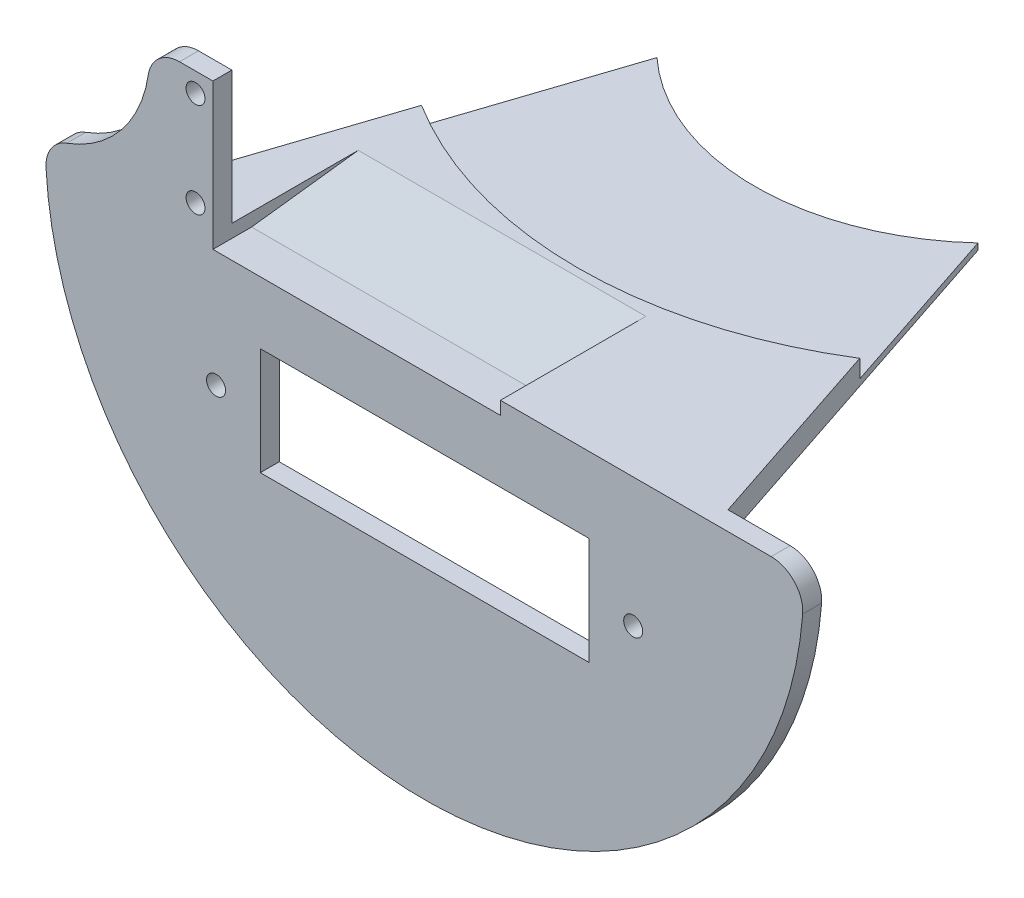
from build123d import *

# Parameters (mm, degrees)
SKETCH1_R           = 1.5
SKETCH1_W           = 52
SKETCH1_H           = 17
BOSS_EXTRUDE1_DEPTH = 3
BOSS_EXTRUDE2_DEPTH = 1
BOSS_EXTRUDE3_DEPTH = 2.822688649
FILLET1_R           = 20
FILLET3_R           = 5
SKETCH6_W           = 45.5
SKETCH6_H           = 2.072688649
CUT_EXTRUDE1_DEPTH  = 3
CHAMFER2_SIZE       = 20
CHAMFER2_SIZE_2     = 2.455691218


with BuildPart() as part:
    # Sketch1 → Boss-Extrude1 (new body)
    with BuildSketch(Plane.XY):
        with BuildLine():
            Line((-33.5, 56.672688649), (-43.5, 56.672688649))
            Line((-43.5, 56.672688649), (-43.5, 35.672688649))
            Line((-43.5, 35.672688649), (-59.995312317, 35.672688649))
            ThreePointArc((-59.995312317, 35.672688649), (-59.999578012, 34.697658936), (-59.9879988, 33.722688649))
            ThreePointArc((-59.9879988, 33.722688649), (0, -25.077311351), (59.9879988, 33.722688649))
            ThreePointArc((59.9879988, 33.722688649), (59.999578012, 34.697658936), (59.995312317, 35.672688649))
            Line((59.995312317, 35.672688649), (12, 35.672688649))
            Line((12, 35.672688649), (-33.5, 35.672688649))
            Line((-33.5, 35.672688649), (-33.5, 56.672688649))
        make_face()
        with Locations((-33, 15.25)):
            Circle(SKETCH1_R, mode=Mode.SUBTRACT)
        with Locations((0, 15.25)):
            Rectangle(SKETCH1_W, SKETCH1_H, mode=Mode.SUBTRACT)
        with Locations((33, 15.25)):
            Circle(SKETCH1_R, mode=Mode.SUBTRACT)
        with Locations((-36.25, 38.6)):
            Circle(SKETCH1_R, mode=Mode.SUBTRACT)
        with Locations((-36.25, 53.6)):
            Circle(SKETCH1_R, mode=Mode.SUBTRACT)
    extrude(amount=BOSS_EXTRUDE1_DEPTH)

    # Sketch4 → Boss-Extrude2 (add)
    with BuildSketch(Plane(origin=(0, 31.85, 0), x_dir=(1, 0, 0), z_dir=(0, 1, 0))):
        with BuildLine():
            Line((-25.4, 59.162140351), (-44.9909991, 0))
            Line((-44.9909991, 0), (45.0090009, 0))
            Line((45.0090009, 0), (25.4, 59.162140351))
            ThreePointArc((25.4, 59.162140351), (0, 49.25), (-25.4, 59.162140351))
        make_face()
    extrude(amount=BOSS_EXTRUDE2_DEPTH)

    # Sketch5 → Boss-Extrude3 (add)
    with BuildSketch(Plane(origin=(0, 32.85, 0), x_dir=(1, 0, 0), z_dir=(0, 1, 0))):
        with BuildLine():
            Line((-34.667242442, 31.176334461), (-44.9909991, 0))
            Line((-44.9909991, 0), (-44.9909991, -3))
            Line((-44.9909991, -3), (45.0090009, -3))
            Line((45.0090009, -3), (45.0090009, 0))
            Line((45.0090009, 0), (34.674298778, 31.180736875))
            ThreePointArc((34.674298778, 31.180736875), (0.004158519, 21.250000132), (-34.667242442, 31.176334461))
        make_face()
    extrude(amount=BOSS_EXTRUDE3_DEPTH)

    # Fillet1
    # the kernel refuses this fillet: 20 mm, written as the material it adds along each edge
    with BuildSketch(Plane(origin=(-43.5, 35.672688649, 0), x_dir=(0, 1, 0), z_dir=(0, 0, 1))) as fillet1_piece_1:
        with BuildLine():
            CenterArc((19.69053489, 20), FILLET1_R, 190.092298101, 79.907701899)
            Line((0, 16.495312317), (-0.393810698, 16.425218563))
            ThreePointArc((-0.393810698, 16.425218563), (-0.4, 8.247656158), (-0.4, 0))
            Line((-0.4, 0), (0, -0.4))
            Line((0, -0.4), (19.69053489, -0.4))
            Line((19.69053489, -0.4), (19.69053489, 0))
        make_face()
    extrude(amount=3)

    # Fillet3
    fillet3_edges = [part.edges().sort_by_distance(p)[0] for p in [
        (59.995312317, 35.672688649, 1.5),
        (-43.5, 56.672688649, 1.5),
        (-59.995312317, 35.672688649, 1.5),
    ]]
    fillet(fillet3_edges, radius=FILLET3_R)

    # Sketch6 → Cut-Extrude1 (cut)
    with BuildSketch(Plane.XY.offset(3)):
        with Locations((-10.75, 34.636344325)):
            Rectangle(SKETCH6_W, SKETCH6_H)
    extrude(amount=-CUT_EXTRUDE1_DEPTH, mode=Mode.SUBTRACT)

    # Chamfer2
    # the kernel refuses this chamfer: 20, 2.455691218 mm, written as the material it takes off along each edge
    with BuildSketch(Plane(origin=(-33.5, 35.672688649, 0), x_dir=(0, 0.00468857506979093, -0.9999890085715016), z_dir=(1, 0, 0))) as chamfer2_piece_1_section:
        Polygon((CHAMFER2_SIZE * 0.999989008572, -CHAMFER2_SIZE * 0.00468857506979), (-CHAMFER2_SIZE_2 * 0.0046885750699, -CHAMFER2_SIZE_2 * 0.999989008595), (0, 0), align=None)
    chamfer2_piece_1 = extrude(amount=45.5, mode=Mode.PRIVATE)
    chamfer2_piece_1 = split(chamfer2_piece_1, bisect_by=Plane(origin=(-10.75, 33.6, -6.806954436), z_dir=(0, 1, 0)), keep=Keep.TOP, mode=Mode.PRIVATE)
    add(chamfer2_piece_1, mode=Mode.SUBTRACT)


solid = part.part
